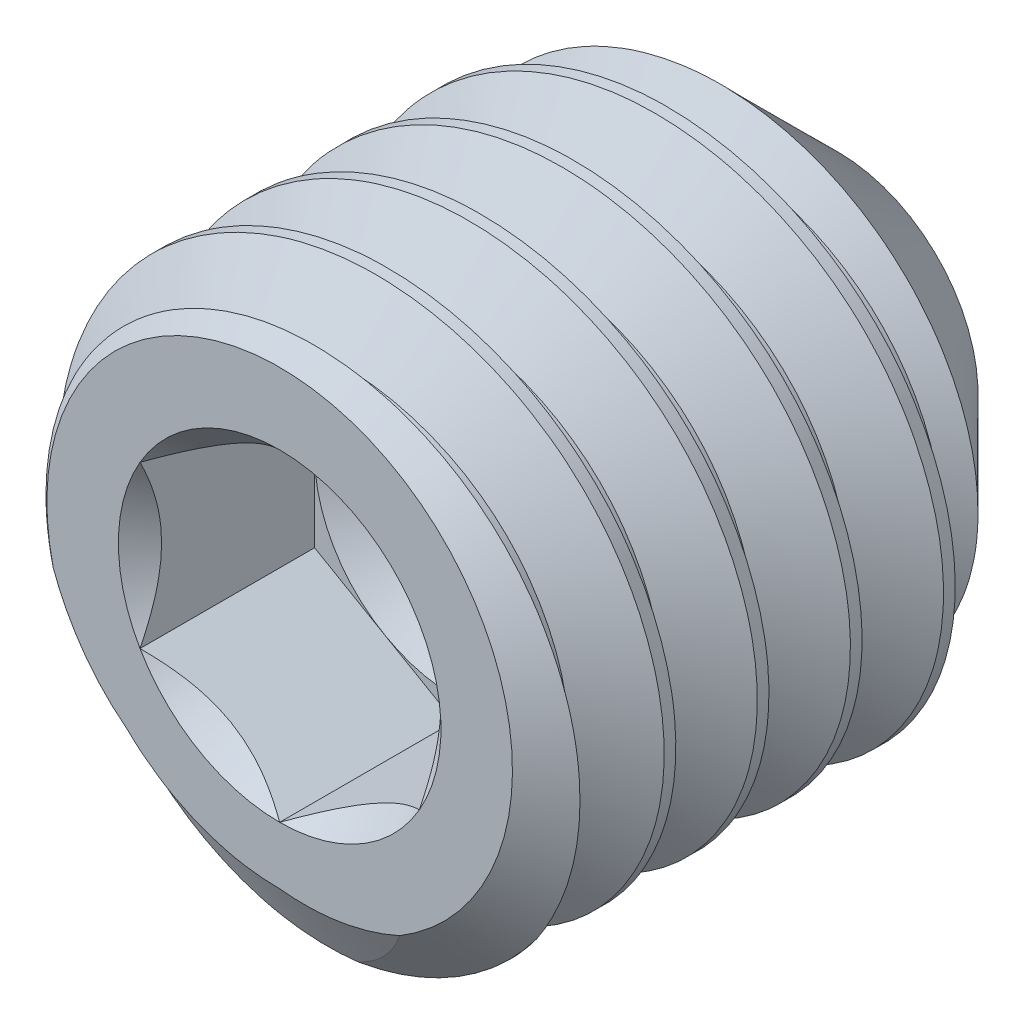
from build123d import *

# Parameters (mm, degrees)
CUT_EXTRUDE1_DEPTH = 0.9375
CUT_SWEEP1_PITCH   = 0.5


with BuildPart() as part:
    # Sketch11 → Revolve1 (revolve)
    with BuildSketch(Plane(origin=(0, 0, 0), x_dir=(0, 0, -1), z_dir=(1, 0, 0)), mode=Mode.PRIVATE) as revolve1_sk:
        Polygon((-1.5, 0), (-1.5, 1.25), (-1.324948115, 1.5), (0.75, 1.5), (1.5, 0.75), (1.049354536, 0), align=None)
    revolve(revolve1_sk.sketch.rotate(Axis((0, 0, -1.049354536), (0, 0, -1)), 180), axis=Axis((0, 0, -1.049354536), (0, 0, -1)))

    # Sketch2 → Cut-Extrude1 (cut)
    with BuildSketch(Plane.XY.offset(1.5)):
        Polygon((0, 0.866025404), (-0.75, 0.433012702), (-0.75, -0.433012702), (0, -0.866025404), (0.75, -0.433012702), (0.75, 0.433012702), align=None)
    extrude(amount=-CUT_EXTRUDE1_DEPTH, mode=Mode.SUBTRACT)

    # Cut-Extrude2 cone 1 section (through the dimple's axis) → Cut-Extrude2 (revolve, cut)
    with BuildSketch(Plane(origin=(0, 0, 1.5), x_dir=(0, -1, 0), z_dir=(1, 0, 0))):
        Polygon((0, 0), (0.866025404, 0), (0, 0.866025404), align=None)
    revolve(axis=Axis((0, 0, 1.5), (0, 0, -1)), mode=Mode.SUBTRACT)

    # Cut-Extrude3 cone 1 section (through the dimple's axis) → Cut-Extrude3 (revolve, cut)
    with BuildSketch(Plane(origin=(0, 0, 0.5625), x_dir=(0, -1, 0), z_dir=(1, 0, 0))):
        Polygon((0, 0), (0.75, 0), (0, 0.433012702), align=None)
    revolve(axis=Axis((0, 0, 0.5625), (0, 0, -1)), mode=Mode.SUBTRACT)

    # Cut-Sweep1: the profile of Sketch6 screwed along a right-hand helix of 6.6 turns, 6 arcs to a turn; built about Z, then put on its axis
    cut_sweep1_z = Axis((0, 0, 0), (0, 0, 1))
    cut_sweep1_corners = [(1.527063294, 0, 0.015625), (1.527063294, 0, -0.453125), (1.175240474, 0, -0.25), (1.175240474, 0, -0.1875)]
    with BuildLine(mode=Mode.PRIVATE) as cut_sweep1_profile:
        Line(cut_sweep1_corners[0], cut_sweep1_corners[1])
        Line(cut_sweep1_corners[1], cut_sweep1_corners[2])
        Line(cut_sweep1_corners[2], cut_sweep1_corners[3])
        Line(cut_sweep1_corners[3], cut_sweep1_corners[0])
    cut_sweep1_cap = Face(cut_sweep1_profile.wire())
    cut_sweep1_turn_angles = [0, 30, 60, 90, 120, 150, 180, 210, 240, 270, 300, 330, 360]
    cut_sweep1_turn_weights = [1, 0.8660254037844387, 1, 0.8660254037844387, 1, 0.8660254037844387, 1, 0.8660254037844387, 1, 0.8660254037844387, 1, 0.8660254037844387, 1]
    cut_sweep1_turn_rails = [Edge.make_bspline([Vector(p[0], p[1], 0).rotate(cut_sweep1_z, cut_sweep1_turn_angles[k]) / cut_sweep1_turn_weights[k] + Vector(0, 0, p[2] + CUT_SWEEP1_PITCH * cut_sweep1_turn_angles[k] / 360) for k in range(13)], [0, 0, 0, 1, 1, 2, 2, 3, 3, 4, 4, 5, 5, 6, 6, 6], 2, cut_sweep1_turn_weights) for p in cut_sweep1_corners]
    cut_sweep1_turn_sides = [Face.make_surface_from_curves(cut_sweep1_turn_rails[p[0]], cut_sweep1_turn_rails[p[1]]) for p in [(0, 1), (1, 2), (2, 3), (3, 0)]]
    cut_sweep1_last_angles = [2160, 2190, 2220, 2250, 2280, 2310, 2340, 2358, 2376]
    cut_sweep1_last_weights = [1, 0.8660254037844387, 1, 0.8660254037844387, 1, 0.8660254037844387, 1, 0.9510565162951389, 1]
    cut_sweep1_last_rails = [Edge.make_bspline([Vector(p[0], p[1], 0).rotate(cut_sweep1_z, cut_sweep1_last_angles[k]) / cut_sweep1_last_weights[k] + Vector(0, 0, p[2] + CUT_SWEEP1_PITCH * cut_sweep1_last_angles[k] / 360) for k in range(9)], [0, 0, 0, 1, 1, 2, 2, 3, 3, 4, 4, 4], 2, cut_sweep1_last_weights) for p in cut_sweep1_corners]
    cut_sweep1_last_sides = [Face.make_surface_from_curves(cut_sweep1_last_rails[p[0]], cut_sweep1_last_rails[p[1]]) for p in [(0, 1), (1, 2), (2, 3), (3, 0)]]
    cut_sweep1 = Plane(origin=(0, 0, -1.5), x_dir=(0, 1, 0), z_dir=(0, 0, 1)) * Solid(Shell([*[p.moved(Location((0, 0, CUT_SWEEP1_PITCH * i))) for i in range(6) for p in cut_sweep1_turn_sides], *cut_sweep1_last_sides, cut_sweep1_cap, cut_sweep1_cap.rotate(cut_sweep1_z, 2376).moved(Location((0, 0, CUT_SWEEP1_PITCH * 2376 / 360)))]))
    add(cut_sweep1, mode=Mode.SUBTRACT)


solid = part.part
